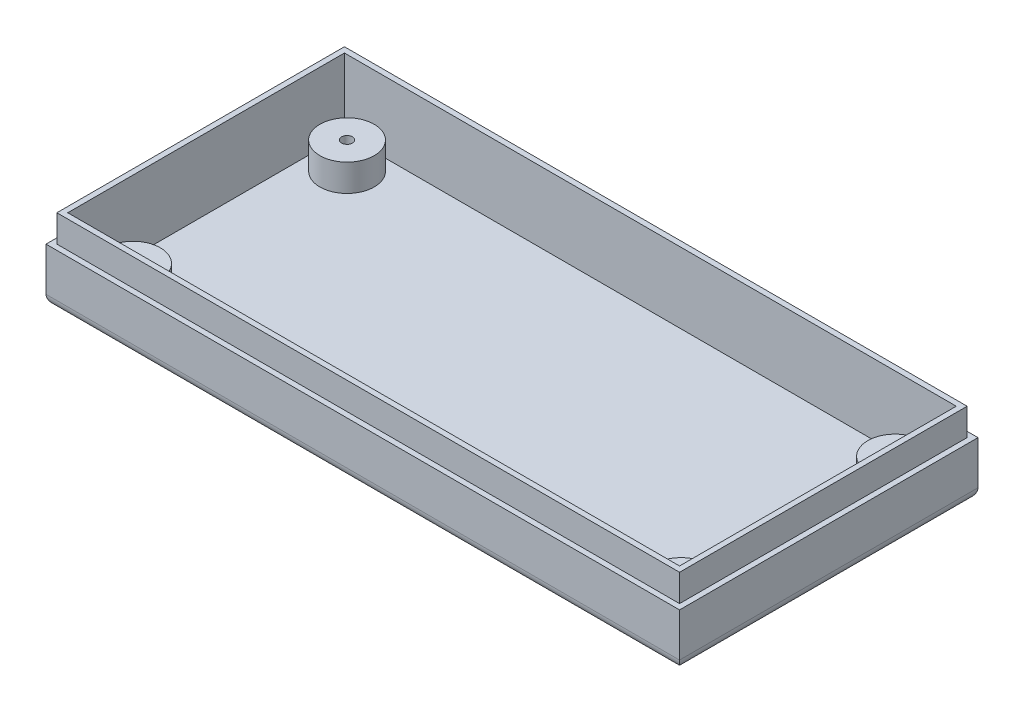
from build123d import *

# Parameters (mm, degrees)
ESQUISSE1_W             = 116.597430489
ESQUISSE1_H             = 54.924972195
BOSS_EXTRU_1_DEPTH      = 10
CONG_1_R                = 2
COQUE2_START            = -86.741708543
COQUE2_OUTLINE_W        = 6
COQUE2_OUTLINE_H        = 50.924972195
COQUE2_DEPTH            = 112.597430489
ESQUISSE2_W             = 112.597430489
ESQUISSE2_H             = 50.924972195
ENL_V_MAT_EXTRU_2_DEPTH = 2
SUPPORT_VIS_R           = 5
SUPPORT_VIS_R_2         = 1
EX_SUPPORT_DEPTH        = 5
PAROIS_W                = 114.597430489
PAROIS_H                = 52.924972195
PAROIS_W_2              = 112.597430489
PAROIS_H_2              = 50.924972195
EX_PAROIS_DEPTH         = 5


# Read off the part's stored shape, not the designer's step: Coque2
with BuildPart() as part:
    # Esquisse1 → Boss.-Extru.1 (new body)
    with BuildSketch(Plane(origin=(0, 0, 0), x_dir=(1, 0, 0), z_dir=(0, 1, 0))):
        with Locations((-30.442993298, -10.699035797)):
            Rectangle(ESQUISSE1_W, ESQUISSE1_H)
    extrude(amount=BOSS_EXTRU_1_DEPTH)

    # Congé1
    cong_1_edges = [part.edges().sort_by_distance(p)[0] for p in [
        (-30.442993298, 0, -16.7634503),
        (27.855721946, 0, 10.699035797),
        (-30.442993298, 0, 38.161521895),
        (-88.741708543, 0, 10.699035797),
    ]]
    fillet(cong_1_edges, radius=CONG_1_R)

    # Coque2 outline → Coque2 (cut)
    with BuildSketch(Plane.YZ.offset(COQUE2_START)):
        with Locations((5, 10.699035797)):
            Rectangle(COQUE2_OUTLINE_W, COQUE2_OUTLINE_H)
    extrude(amount=COQUE2_DEPTH, mode=Mode.SUBTRACT)

    # Esquisse2 → Enlèv. mat.-Extru.2 (cut)
    with BuildSketch(Plane(origin=(0, 10, 0), x_dir=(1, 0, 0), z_dir=(0, 1, 0))):
        with Locations((-30.442993298, -10.699035797)):
            Rectangle(ESQUISSE2_W, ESQUISSE2_H)
    extrude(amount=-ENL_V_MAT_EXTRU_2_DEPTH, mode=Mode.SUBTRACT)

    # support_vis → ex_support (add)
    # profile 1 of 4: a face of its own
    with BuildSketch(Plane(origin=(0, 2, 0), x_dir=(1, 0, 0), z_dir=(0, 1, 0))):
        with Locations(Location((-80.641833666, 9.143982461, 0), (0, 0, 270))):
            Circle(SUPPORT_VIS_R)
        with Locations(Location((-80.641833666, 9.143982461, 0), (0, 0, 270))):
            Circle(SUPPORT_VIS_R_2, mode=Mode.SUBTRACT)
    # profile 2 of 4: a face of its own
    with BuildSketch(Plane(origin=(0, 2, 0), x_dir=(1, 0, 0), z_dir=(0, 1, 0))):
        with Locations(Location((20.198166334, 9.143982461, 0), (0, 0, 270))):
            Circle(SUPPORT_VIS_R)
        with Locations(Location((20.198166334, 9.143982461, 0), (0, 0, 270))):
            Circle(SUPPORT_VIS_R_2, mode=Mode.SUBTRACT)
    # profile 3 of 4: a face of its own
    with BuildSketch(Plane(origin=(0, 2, 0), x_dir=(1, 0, 0), z_dir=(0, 1, 0))):
        with Locations(Location((-80.641833666, -30.226017539, 0), (0, 0, 270))):
            Circle(SUPPORT_VIS_R)
        with Locations(Location((-80.641833666, -30.226017539, 0), (0, 0, 270))):
            Circle(SUPPORT_VIS_R_2, mode=Mode.SUBTRACT)
    # profile 4 of 4: a face of its own
    with BuildSketch(Plane(origin=(0, 2, 0), x_dir=(1, 0, 0), z_dir=(0, 1, 0))):
        with Locations(Location((20.198166334, -30.226017539, 0), (0, 0, 270))):
            Circle(SUPPORT_VIS_R)
        with Locations(Location((20.198166334, -30.226017539, 0), (0, 0, 270))):
            Circle(SUPPORT_VIS_R_2, mode=Mode.SUBTRACT)
    extrude(amount=EX_SUPPORT_DEPTH)

    # parois → ex_parois (add)
    with BuildSketch(Plane(origin=(0, 10, 0), x_dir=(1, 0, 0), z_dir=(0, 1, 0))):
        with Locations((-30.442993298, -10.699035797)):
            Rectangle(PAROIS_W, PAROIS_H)
        with Locations((-30.442993298, -10.699035797)):
            Rectangle(PAROIS_W_2, PAROIS_H_2, mode=Mode.SUBTRACT)
    extrude(amount=EX_PAROIS_DEPTH)


solid = part.part
